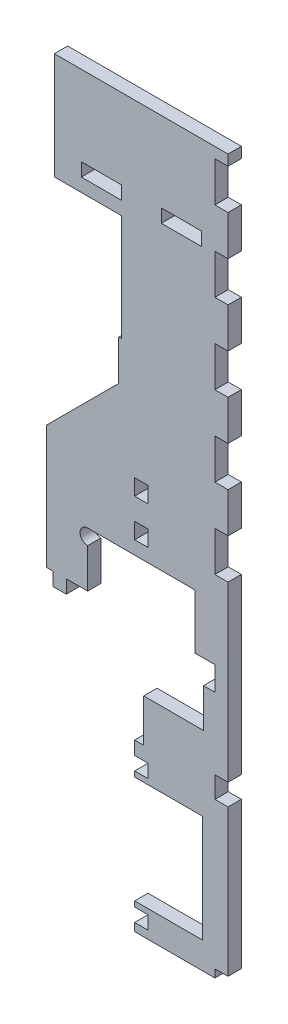
from build123d import *

# Parameters (mm, degrees)
BOSS_EXTRU_1_DEPTH      = 5
ESQUISSE2_R             = 2.8575
ESQUISSE2_W             = 5
ESQUISSE2_H             = 6
ESQUISSE2_W_2           = 4.274370263
ESQUISSE2_H_2           = 8.980069935
ESQUISSE2_W_3           = 4.92
ESQUISSE2_H_3           = 3
ESQUISSE2_H_4           = 8
ESQUISSE2_H_5           = 15
ESQUISSE2_W_4           = 15
ESQUISSE2_H_6           = 5
ESQUISSE2_W_5           = 1
ESQUISSE2_H_7           = 40
ENL_V_MAT_EXTRU_1_DEPTH = 5
ESQUISSE3_W             = 5
ESQUISSE3_H             = 5
BOSS_EXTRU_2_DEPTH      = 5


with BuildPart() as part:
    # Esquisse1 → Boss.-Extru.1 (new body)
    with BuildSketch(Plane.XY):
        Polygon((65.121094869, 0), (30.122364869, 0), (30.122364869, 3), (35.122364869, 3), (35.122364869, 8), (30.122364869, 8), (30.122364869, 10), (55.617614869, 10), (55.617614869, 50.2), (30.122364869, 50.2), (30.122364869, 52.2), (35.122364869, 52.2), (35.122364869, 57.2), (30.122364869, 57.2), (30.122364869, 62.2), (33.512280837, 62.2), (33.512280837, 78.240708175), (55.911629737, 78.240708175), (55.911629737, 101.750434868), (52.693, 101.750434868), (52.693, 122.246954868), (12.493, 122.246954868), (12.493, 101.750434868), (-2.878905131, 101.750434868), (-2.878905131, 148), (24.121094869, 175), (24.121094869, 230), (0, 230), (0, 270), (65.121094869, 270), align=None)
    extrude(amount=-BOSS_EXTRU_1_DEPTH)

    # Esquisse2 → Enlèv. mat.-Extru.1 (cut)
    with BuildSketch(Plane.XY):
        with Locations((12.493, 119.389454868)):
            Circle(ESQUISSE2_R)
        with Locations((32.622364869, 144.401636706)):
            Rectangle(ESQUISSE2_W, ESQUISSE2_H)
        with Locations((32.622364869, 130.246954868)):
            Rectangle(ESQUISSE2_W, ESQUISSE2_H)
        with Locations((58.048814869, 97.260399901)):
            Rectangle(ESQUISSE2_W_2, ESQUISSE2_H_2)
        with Locations((62.661094869, 1.5)):
            Rectangle(ESQUISSE2_W_3, ESQUISSE2_H_3)
        with Locations((62.661094869, 62)):
            Rectangle(ESQUISSE2_W_3, ESQUISSE2_H_4)
        with Locations((62.661094869, 168.5)):
            Rectangle(ESQUISSE2_W_3, ESQUISSE2_H_5)
        with Locations((62.661094869, 138.5)):
            Rectangle(ESQUISSE2_W_3, ESQUISSE2_H_5)
        with Locations((62.661094869, 198.5)):
            Rectangle(ESQUISSE2_W_3, ESQUISSE2_H_5)
        with Locations((62.661094869, 228.5)):
            Rectangle(ESQUISSE2_W_3, ESQUISSE2_H_5)
        with Locations((62.661094869, 258.5)):
            Rectangle(ESQUISSE2_W_3, ESQUISSE2_H_5)
        with Locations((47.621094869, 237.5)):
            Rectangle(ESQUISSE2_W_4, ESQUISSE2_H_6)
        with Locations((17.621094869, 237.5)):
            Rectangle(ESQUISSE2_W_4, ESQUISSE2_H_6)
        with Locations((24.621094869, 210)):
            Rectangle(ESQUISSE2_W_5, ESQUISSE2_H_7)
    extrude(amount=-ENL_V_MAT_EXTRU_1_DEPTH, mode=Mode.SUBTRACT)

    # Esquisse3 → Boss.-Extru.2 (add)
    with BuildSketch(Plane.XY):
        with Locations((1.993, 99.250434868)):
            Rectangle(ESQUISSE3_W, ESQUISSE3_H)
    extrude(amount=-BOSS_EXTRU_2_DEPTH)


solid = part.part
